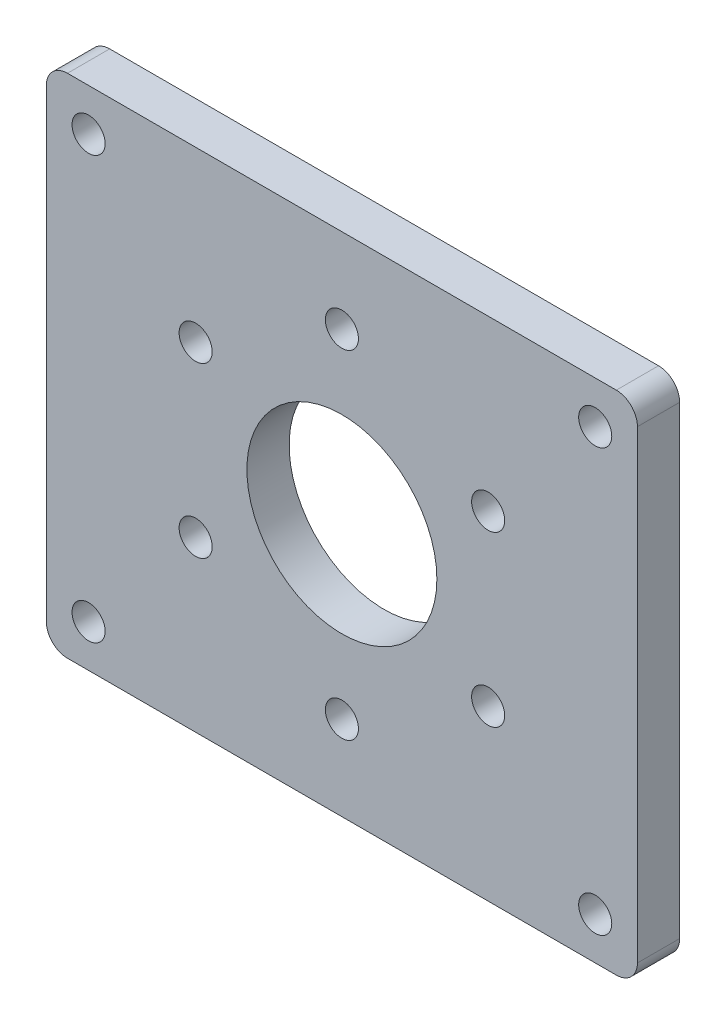
from build123d import *

# Parameters (mm, degrees)
SKETCH1_W           = 88.9
SKETCH1_H           = 76.2
SKETCH1_R           = 2.4892
SKETCH1_R_2         = 14.2875
BOSS_EXTRUDE1_DEPTH = 6.35
FILLET1_R           = 3.175


with BuildPart() as part:
    # Sketch1 → Boss-Extrude1 (new body)
    with BuildSketch(Plane.XY):
        Rectangle(SKETCH1_W, SKETCH1_H)
        with Locations((-38.1, -31.75)):
            Circle(SKETCH1_R, mode=Mode.SUBTRACT)
        with Locations((38.1, -31.75)):
            Circle(SKETCH1_R, mode=Mode.SUBTRACT)
        with Locations((-38.1, 31.75)):
            Circle(SKETCH1_R, mode=Mode.SUBTRACT)
        with Locations((38.1, 31.75)):
            Circle(SKETCH1_R, mode=Mode.SUBTRACT)
        with Locations((21.997045256, 12.7)):
            Circle(SKETCH1_R, mode=Mode.SUBTRACT)
        with Locations((-21.997045256, -12.7)):
            Circle(SKETCH1_R, mode=Mode.SUBTRACT)
        Circle(SKETCH1_R_2, mode=Mode.SUBTRACT)
        with Locations((0, -25.4)):
            Circle(SKETCH1_R, mode=Mode.SUBTRACT)
        with Locations((21.997045256, -12.7)):
            Circle(SKETCH1_R, mode=Mode.SUBTRACT)
        with Locations((-21.997045256, 12.7)):
            Circle(SKETCH1_R, mode=Mode.SUBTRACT)
        with Locations((0, 25.4)):
            Circle(SKETCH1_R, mode=Mode.SUBTRACT)
    extrude(amount=BOSS_EXTRUDE1_DEPTH)

    # Fillet1
    fillet1_edges = [part.edges().sort_by_distance(p)[0] for p in [
        (-44.45, -38.1, 3.175),
        (44.45, 38.1, 3.175),
        (44.45, -38.1, 3.175),
        (-44.45, 38.1, 3.175),
    ]]
    fillet(fillet1_edges, radius=FILLET1_R)


solid = part.part
